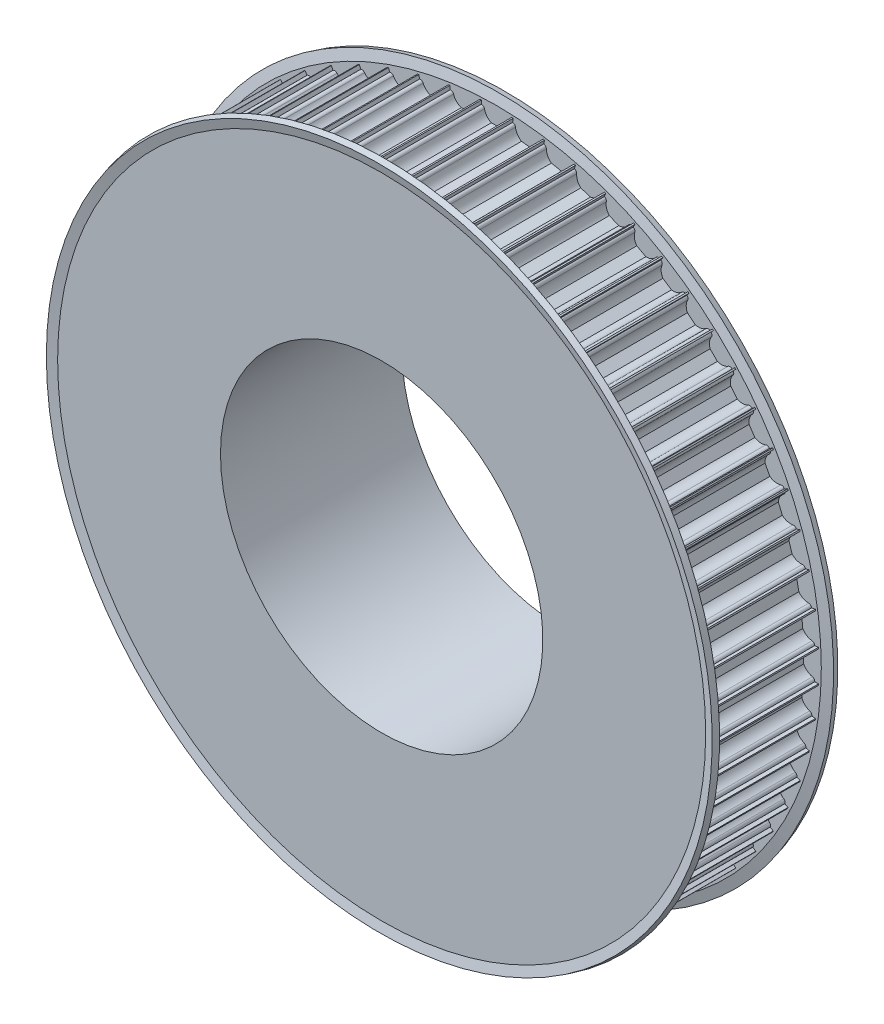
from build123d import *

# Parameters (mm, degrees)
CUT_EXTRUDE1_DEPTH = 48
CIRPATTERN1_COUNT  = 64


with BuildPart() as part:
    # Sketch1 → Revolve1 (revolve)
    with BuildSketch(Plane(origin=(0, 0, 0), x_dir=(0, 0, -1), z_dir=(1, 0, 0))):
        Polygon((0, 40), (0, 80), (30, 80), (30, 55.5), (45, 55.5), (45, 40), align=None)
    revolve(axis=Axis((0, 0, -88.99), (0, 0, 1)))

    # Sketch2 → Cut-Extrude1 (cut)
    with BuildSketch(Plane.XY):
        with BuildLine():
            Line((3.707104402, 79), (3.75, 79))
            Line((3.75, 79), (3.75, 81))
            Line((3.75, 81), (-3.75, 81))
            Line((-3.75, 81), (-3.75, 79))
            Line((-3.75, 79), (-3.707104402, 79))
            ThreePointArc((-3.707104402, 79), (-3.232258052, 78.83053505), (-2.97199787, 78.398722517))
            ThreePointArc((-2.97199787, 78.398722517), (-2.380891342, 77.122325275), (-1.277421604, 76.25))
            Line((-1.277421604, 76.25), (1.277421604, 76.25))
            ThreePointArc((1.277421604, 76.25), (2.380891342, 77.122325275), (2.97199787, 78.398722517))
            ThreePointArc((2.97199787, 78.398722517), (3.232258052, 78.83053505), (3.707104402, 79))
        make_face()
    cut_extrude1 = extrude(amount=-CUT_EXTRUDE1_DEPTH, mode=Mode.SUBTRACT)

    # CirPattern1: Cut-Extrude1 ×64 about axis
    cirpattern1_axis = Axis((0, 0, -88.99), (0, 0, 1))
    for i in range(1, CIRPATTERN1_COUNT):
        add(cut_extrude1.rotate(cirpattern1_axis, i * 360 / CIRPATTERN1_COUNT), mode=Mode.SUBTRACT)

    # Sketch3 → Revolve2 (revolve)
    with BuildSketch(Plane(origin=(0, 0, 0), x_dir=(0, 0, -1), z_dir=(1, 0, 0))):
        Polygon((-0.591966801, 82.623832474), (0, 80.414582296), (0, 75.612061042), (1.5, 75.612061042), (1.5, 80.612061042), (0.856921938, 83.012061042), align=None)
        Polygon((30.591966801, 82.623832474), (29.143078062, 83.012061042), (28.5, 80.612061042), (28.5, 75.612061042), (30, 75.612061042), (30, 80.414582296), align=None)
    revolve(axis=Axis((0, 0, -88.99), (0, 0, 1)))


solid = part.part
